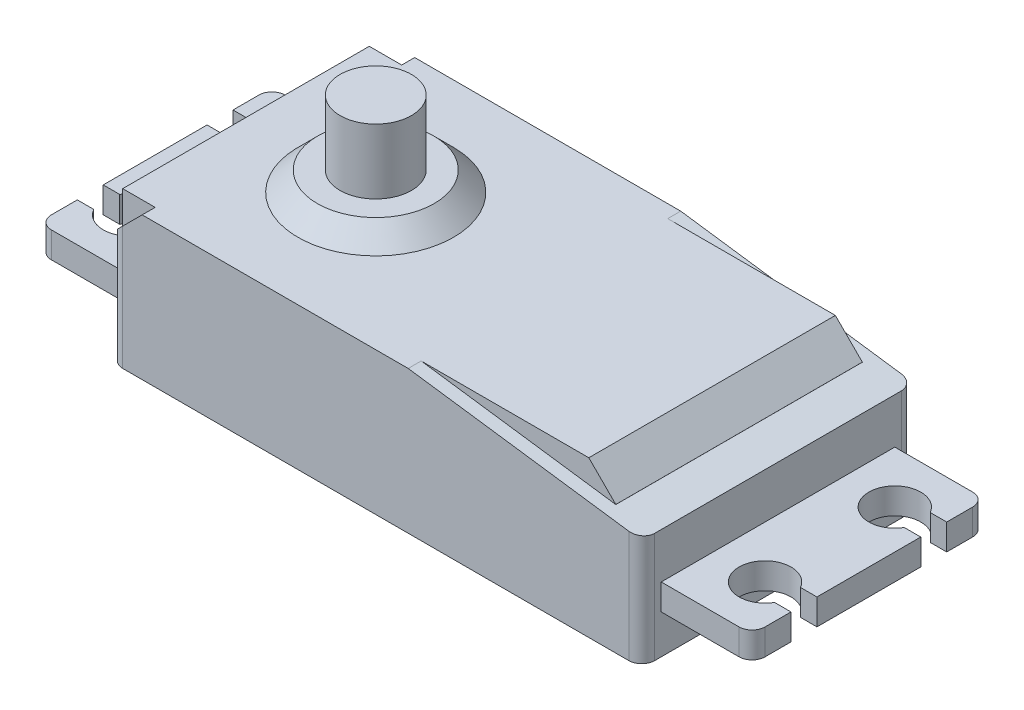
from build123d import *

# Parameters (mm, degrees)
BOSS_EXTRU_1_DEPTH      = 11
ENL_V_MAT_EXTRU_1_DEPTH = 48.360320945
ESQUISSE6_W             = 24.300768243
ESQUISSE6_H             = 19
BOSS_EXTRU_2_DEPTH      = 5
CHANFREIN1_SIZE         = 2.08
ESQUISSE7_R             = 6
BOSS_EXTRU_3_DEPTH      = 1.5
CHANFREIN2_SIZE         = 1.5
ENL_V_MAT_EXTRU_2_DEPTH = 1
ENL_V_MAT_EXTRU_3_DEPTH = 1
ESQUISSE11_W            = 18
ESQUISSE11_H            = 2
BOSS_EXTRU_4_DEPTH      = 7
ENL_V_MAT_EXTRU_5_DEPTH = 47.671725916
CONG_1_R                = 1
CONG_1_OF_SYM_TRIE1_R   = 1
COQUE1_START            = -20
COQUE1_DEPTH            = 19
COQUE1_START_2          = -19
COQUE1_2_DEPTH          = 17
ESQUISSE18_R            = 2.75
BOSS_EXTRU_5_DEPTH      = 5


with BuildPart() as part:
    # Esquisse3 → Boss.-Extru.1 (new body)
    with BuildSketch(Plane(origin=(0, 0, 0), x_dir=(1, 0, 0), z_dir=(0, 1, 0))):
        with BuildLine():
            Line((1, 0), (40, 0))
            ThreePointArc((40, 0), (40.707106781, 0.292893219), (41, 1))
            Line((41, 1), (41, 20))
            ThreePointArc((41, 20), (40.707106781, 20.707106781), (40, 21))
            Line((40, 21), (1, 21))
            ThreePointArc((1, 21), (0.292893219, 20.707106781), (0, 20))
            Line((0, 20), (0, 1))
            ThreePointArc((0, 1), (0.292893219, 0.292893219), (1, 0))
        make_face()
    extrude(amount=BOSS_EXTRU_1_DEPTH)

    # Esquisse4 → Enlèv. mat.-Extru.1 (cut, through all)
    with BuildSketch(Plane.XY):
        Polygon((41, 11), (23, 11), (41, 8.5), align=None)
    extrude(amount=-ENL_V_MAT_EXTRU_1_DEPTH, mode=Mode.SUBTRACT)

    # Esquisse6 → Boss.-Extru.2 (add)
    with BuildSketch(Plane(origin=(0, 11, 0), x_dir=(1, 0, 0), z_dir=(0, 1, 0))):
        with Locations((25.849615878, 10.5)):
            Rectangle(ESQUISSE6_W, ESQUISSE6_H)
    extrude(amount=-BOSS_EXTRU_2_DEPTH)

    # Chanfrein1
    chanfrein1_edges = [part.edges().sort_by_distance(p)[0] for p in [
        (38, 11, -10.5),
    ]]
    chamfer(chanfrein1_edges, length=CHANFREIN1_SIZE)

    # Esquisse7 → Boss.-Extru.3 (add)
    with BuildSketch(Plane(origin=(0, 11, 0), x_dir=(1, 0, 0), z_dir=(0, 1, 0))):
        with Locations(Location((10, 10.5, 0), (0, 0, 90))):
            Circle(ESQUISSE7_R)
    extrude(amount=BOSS_EXTRU_3_DEPTH)

    # Chanfrein2
    chanfrein2_edges = [part.edges().sort_by_distance(p)[0] for p in [
        (10, 12.5, -4.5),
    ]]
    chamfer(chanfrein2_edges, length=CHANFREIN2_SIZE - 0.0001)  # a hair under: the kernel refuses the full size

    # Esquisse8 → Enlèv. mat.-Extru.2 (cut)
    with BuildSketch(Plane.XY):
        Polygon((0, 11), (2.5, 11), (0, 8.5), align=None)
    extrude(amount=-ENL_V_MAT_EXTRU_2_DEPTH, mode=Mode.SUBTRACT)

    # Esquisse9 → Enlèv. mat.-Extru.3 (cut)
    with BuildSketch(Plane(origin=(0, 0, -21), x_dir=(-1, 0, 0), z_dir=(0, 0, -1))):
        Polygon((0, 11), (-2.5, 11), (0, 8.5), align=None)
    extrude(amount=-ENL_V_MAT_EXTRU_3_DEPTH, mode=Mode.SUBTRACT)

    # Esquisse11 → Boss.-Extru.4 (add)
    with BuildSketch(Plane.ZY):
        with Locations((-10.5, 4)):
            Rectangle(ESQUISSE11_W, ESQUISSE11_H)
    boss_extru_4 = extrude(amount=BOSS_EXTRU_4_DEPTH)

    # Esquisse15 → Enlèv. mat.-Extru.5 (cut, through all)
    with BuildSketch(Plane(origin=(0, 5, 0), x_dir=(1, 0, 0), z_dir=(0, 1, 0))):
        with BuildLine():
            Line((-9.636099445, 16.5), (-5.732050808, 16.5))
            ThreePointArc((-5.732050808, 16.5), (-2, 15.5), (-5.732050808, 14.5))
            Line((-5.732050808, 14.5), (-9.636099445, 14.5))
            Line((-9.636099445, 14.5), (-9.636099445, 16.5))
        make_face()
        with BuildLine():
            Line((-9.636099445, 4.5), (-5.732050808, 4.5))
            ThreePointArc((-5.732050808, 4.5), (-2, 5.5), (-5.732050808, 6.5))
            Line((-5.732050808, 6.5), (-9.636099445, 6.5))
            Line((-9.636099445, 6.5), (-9.636099445, 4.5))
        make_face()
    enl_v_mat_extru_5 = extrude(amount=-ENL_V_MAT_EXTRU_5_DEPTH, mode=Mode.SUBTRACT)

    # Congé1
    cong_1_edges = [part.edges().sort_by_distance(p)[0] for p in [
        (-7, 4, -19.5),
        (-7, 4, -1.5),
    ]]
    fillet(cong_1_edges, radius=CONG_1_R)

    # Symétrie1: Boss.-Extru.4, Enlèv. mat.-Extru.5 across plane
    add(boss_extru_4.mirror(Plane.ZY.offset(-20.5)))
    add(enl_v_mat_extru_5.mirror(Plane.ZY.offset(-20.5)), mode=Mode.SUBTRACT)

    # Congé1 of Symétrie1
    cong_1_of_sym_trie1_edges = [part.edges().sort_by_distance(p)[0] for p in [
        (48, 4, -19.5),
        (48, 4, -1.5),
    ]]
    fillet(cong_1_of_sym_trie1_edges, radius=CONG_1_OF_SYM_TRIE1_R)

    # Coque1: read off the stored shape, not the designer's step
    # Coque1 outline → Coque1 (cut)
    with BuildSketch(Plane.XY.offset(COQUE1_START)):
        Polygon((1, 8.085786438), (1, 0), (40, 0), (40, 7.629289897), (22.930887262, 10), (2.914213562, 10), align=None)
    extrude(amount=COQUE1_DEPTH, mode=Mode.SUBTRACT)

    # Coque1 2 outline → Coque1 2 (cut)
    with BuildSketch(Plane.XY.offset(COQUE1_START_2)):
        Polygon((1, 10), (1, 8.085786438), (2.914213562, 10), align=None)
        Polygon((35.505786438, 10), (22.930887262, 10), (37, 8.045956564), (37, 8.505786438), align=None)
    extrude(amount=COQUE1_2_DEPTH, mode=Mode.SUBTRACT)

    # Coque1 3 outline → Coque1 3 (revolve, cut)
    with BuildSketch(Plane(origin=(10, 0, -10.5), x_dir=(1, 0, 0), z_dir=(0, 0, 1))):
        Polygon((4.085786438, 11.5), (0, 11.5), (0, 10), (5.585786438, 10), align=None)
    revolve(axis=Axis((10, 0, -10.5), (0, 1, 0)), mode=Mode.SUBTRACT)

    # Esquisse18 → Boss.-Extru.5 (add)
    with BuildSketch(Plane(origin=(0, 12.5, 0), x_dir=(1, 0, 0), z_dir=(0, 1, 0))):
        with Locations(Location((10, 10.5, 0), (0, 0, 270))):
            Circle(ESQUISSE18_R)
    extrude(amount=BOSS_EXTRU_5_DEPTH)


solid = part.part
